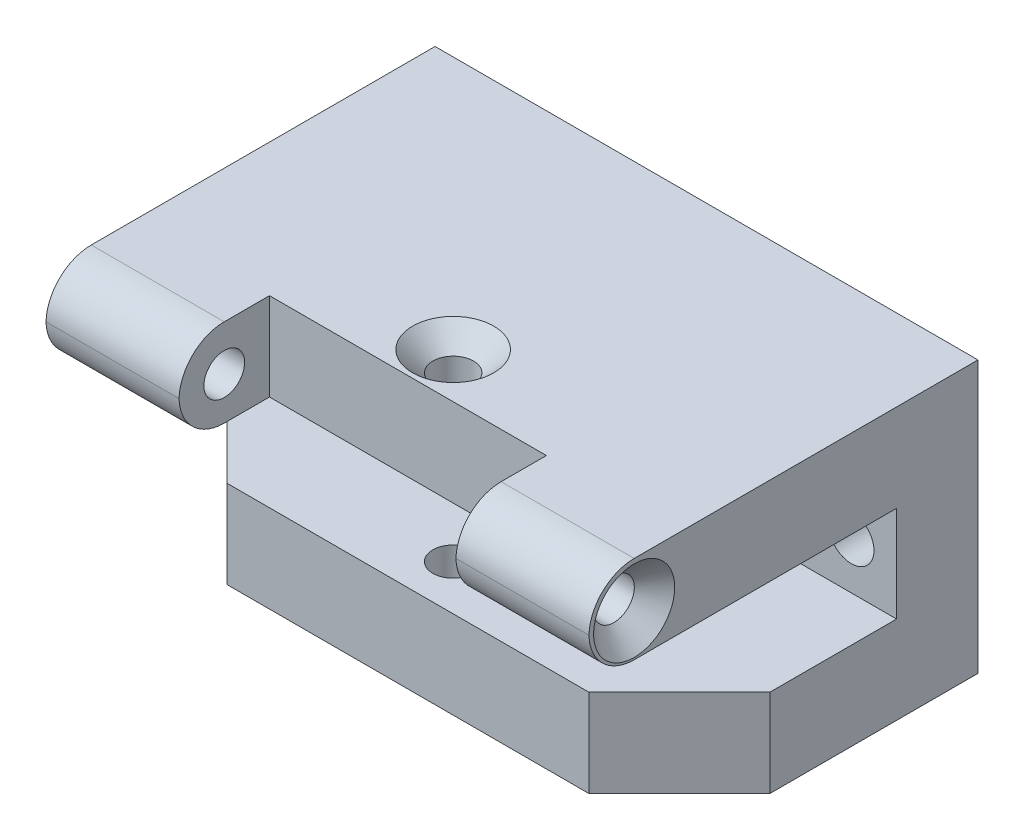
from build123d import *

# Parameters (mm, degrees)
SKETCH1_W                               = 60
SKETCH1_H                               = 30
BOSS_EXTRUDE1_DEPTH                     = 9
SKETCH2_W                               = 60
SKETCH2_H                               = 9.7
BOSS_EXTRUDE2_DEPTH                     = 24
CHAMFER1_SIZE                           = 10
CSK_FOR_M4_SFHCS1_D                     = 4.5
CSK_FOR_M4_SFHCS1_DEPTH                 = 12
CSK_FOR_M4_SFHCS1_CSINK_D               = 8.96
CSK_FOR_M4_SFHCS1_CSINK_ANGLE           = 90
CSK_FOR_M4_SFHCS1_TIP                   = 1.351936393
CSK_FOR_M4_SFHCS3_D                     = 4.5
CSK_FOR_M4_SFHCS3_DEPTH                 = 12
CSK_FOR_M4_SFHCS3_CSINK_D               = 8.96
CSK_FOR_M4_SFHCS3_CSINK_ANGLE           = 90
CSK_FOR_M4_SFHCS3_TIP                   = 1.351936393
CBORE_FOR_M5_HEX_HEAD_BOLT2_D           = 4.5
CBORE_FOR_M5_HEX_HEAD_BOLT2_DEPTH       = 12
CBORE_FOR_M5_HEX_HEAD_BOLT2_CBORE_D     = 5
CBORE_FOR_M5_HEX_HEAD_BOLT2_CBORE_DEPTH = 4.2
CBORE_FOR_M5_HEX_HEAD_BOLT2_TIP         = 1.351936393
SKETCH9_W                               = 14.7
SKETCH9_H                               = 9.7
BOSS_EXTRUDE3_DEPTH                     = 10
CSK_FOR_M4_SFHCS2_D                     = 4.5
CSK_FOR_M4_SFHCS2_CSINK_D               = 8.96
CSK_FOR_M4_SFHCS2_CSINK_ANGLE           = 90
FILLET1_R                               = 5


with BuildPart() as part:
    # Sketch1 → Boss-Extrude1 (new body)
    with BuildSketch(Plane.XY):
        Rectangle(SKETCH1_W, SKETCH1_H)
    extrude(amount=BOSS_EXTRUDE1_DEPTH)

    # Sketch2 → Boss-Extrude2 (add)
    with BuildSketch(Plane.XY.offset(9)):
        with Locations((0, 10.15)):
            Rectangle(SKETCH2_W, SKETCH2_H)
        with Locations((0, -10.15)):
            Rectangle(SKETCH2_W, SKETCH2_H)
    extrude(amount=BOSS_EXTRUDE2_DEPTH)

    # Chamfer1
    chamfer1_edges = [part.edges().sort_by_distance(p)[0] for p in [
        (30, -10.15, 33),
        (-30, -10.15, 33),
    ]]
    chamfer(chamfer1_edges, length=CHAMFER1_SIZE)

    # CSK for M4 SFHCS1
    with Locations(Plane(origin=(0, -15, 0), x_dir=(-1, 0, 0), z_dir=(0, -1, 0))):
        with Locations((0, -28)):
            CounterSinkHole(CSK_FOR_M4_SFHCS1_D / 2, CSK_FOR_M4_SFHCS1_CSINK_D / 2, depth=CSK_FOR_M4_SFHCS1_DEPTH, counter_sink_angle=CSK_FOR_M4_SFHCS1_CSINK_ANGLE)
            with Locations((0, 0, -(CSK_FOR_M4_SFHCS1_DEPTH + CSK_FOR_M4_SFHCS1_TIP / 2))):  # 118° drill point
                Cone(0, CSK_FOR_M4_SFHCS1_D / 2, CSK_FOR_M4_SFHCS1_TIP, mode=Mode.SUBTRACT)

    # CSK for M4 SFHCS3
    with Locations(Plane(origin=(0, 15, 0), x_dir=(1, 0, 0), z_dir=(0, 1, 0))):
        with Locations((0, -28)):
            CounterSinkHole(CSK_FOR_M4_SFHCS3_D / 2, CSK_FOR_M4_SFHCS3_CSINK_D / 2, depth=CSK_FOR_M4_SFHCS3_DEPTH, counter_sink_angle=CSK_FOR_M4_SFHCS3_CSINK_ANGLE)
            with Locations((0, 0, -(CSK_FOR_M4_SFHCS3_DEPTH + CSK_FOR_M4_SFHCS3_TIP / 2))):  # 118° drill point
                Cone(0, CSK_FOR_M4_SFHCS3_D / 2, CSK_FOR_M4_SFHCS3_TIP, mode=Mode.SUBTRACT)

    # CBORE for M5 Hex Head Bolt2
    with Locations(Plane.XY.offset(9)):
        with Locations((-25, 0), (25, 0)):
            CounterBoreHole(CBORE_FOR_M5_HEX_HEAD_BOLT2_D / 2, CBORE_FOR_M5_HEX_HEAD_BOLT2_CBORE_D / 2, CBORE_FOR_M5_HEX_HEAD_BOLT2_CBORE_DEPTH, depth=CBORE_FOR_M5_HEX_HEAD_BOLT2_DEPTH)
            with Locations((0, 0, -(CBORE_FOR_M5_HEX_HEAD_BOLT2_DEPTH + CBORE_FOR_M5_HEX_HEAD_BOLT2_TIP / 2))):  # 118° drill point
                Cone(0, CBORE_FOR_M5_HEX_HEAD_BOLT2_D / 2, CBORE_FOR_M5_HEX_HEAD_BOLT2_TIP, mode=Mode.SUBTRACT)

    # Sketch9 → Boss-Extrude3 (add)
    with BuildSketch(Plane.XY.offset(33)):
        with Locations((-22.65, 10.15)):
            Rectangle(SKETCH9_W, SKETCH9_H)
    boss_extrude3 = extrude(amount=BOSS_EXTRUDE3_DEPTH)

    # CSK for M4 SFHCS2 (through all)
    with Locations(Plane.ZY.offset(30)):
        with Locations((38, 10)):
            csk_for_m4_sfhcs2 = CounterSinkHole(CSK_FOR_M4_SFHCS2_D / 2, CSK_FOR_M4_SFHCS2_CSINK_D / 2, counter_sink_angle=CSK_FOR_M4_SFHCS2_CSINK_ANGLE)

    # Mirror1: Boss-Extrude3, CSK for M4 SFHCS2 across plane
    add(boss_extrude3.mirror(Plane(origin=(0, 0, 0), x_dir=(0, 0, 1), z_dir=(1, 0, 0))))
    add(csk_for_m4_sfhcs2.mirror(Plane(origin=(0, 0, 0), x_dir=(0, 0, 1), z_dir=(1, 0, 0))), mode=Mode.SUBTRACT)

    # Fillet1
    # the kernel refuses this fillet: 5 mm, written as the material it takes off along each edge
    with BuildSketch(Plane(origin=(2.8, 5.3, 43), x_dir=(0, 0, -1), z_dir=(1, 0, 0)), Plane(origin=(42.5, 15, 43), x_dir=(0, 0, -1), z_dir=(-1, 0, 0))) as fillet1_piece_1:
        with BuildLine():
            CenterArc((FILLET1_R, FILLET1_R), FILLET1_R, 180, 90)
            Line((0, FILLET1_R), (0, 0))
            Line((0, 0), (FILLET1_R, 0))
        make_face()
    extrude(amount=39.7, mode=Mode.SUBTRACT)
    with BuildSketch(Plane(origin=(-2.8, 5.3, 43), x_dir=(0, 0, -1), z_dir=(-1, 0, 0)), Plane(origin=(-42.5, 15, 43), x_dir=(0, 0, -1), z_dir=(1, 0, 0))) as fillet1_piece_2:
        with BuildLine():
            CenterArc((FILLET1_R, -FILLET1_R), FILLET1_R, 90, 90)
            Line((0, -FILLET1_R), (0, 0))
            Line((0, 0), (FILLET1_R, 0))
        make_face()
    extrude(amount=39.7, mode=Mode.SUBTRACT)


solid = part.part
